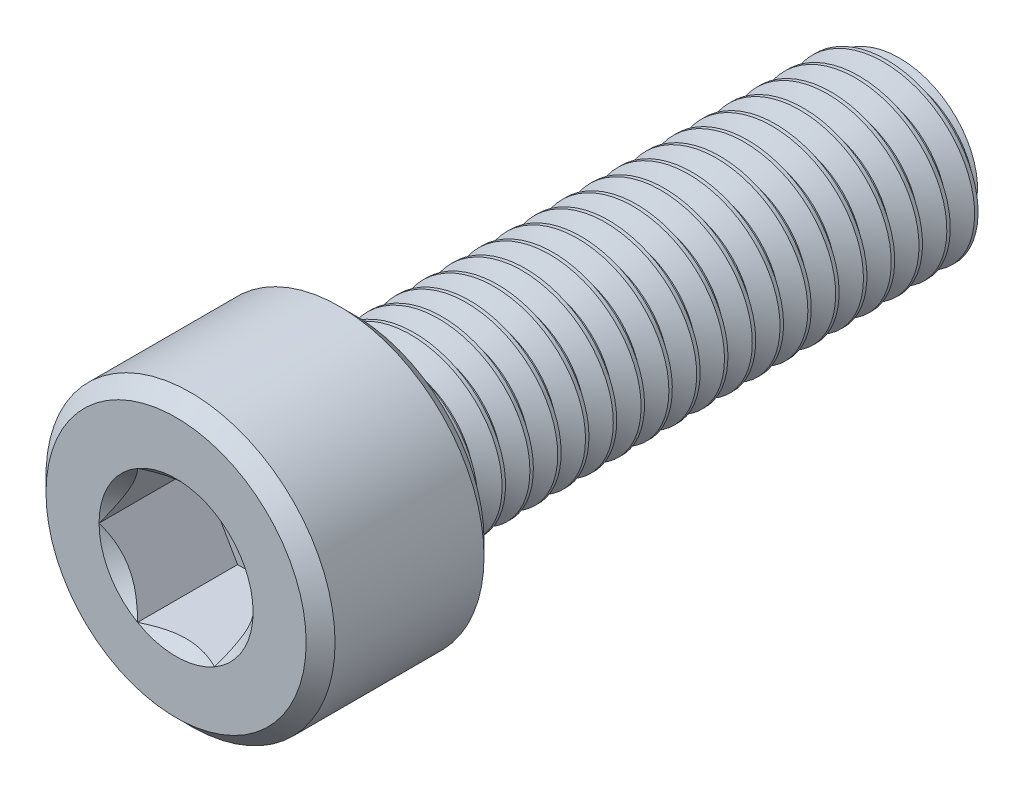
from build123d import *

# Parameters (mm, degrees)
SKETCH1_R           = 4
BOSS_EXTRUDE1_DEPTH = 25
CUT_SWEEP1_PITCH    = 1.25
SKETCH5_R           = 6.5
BOSS_EXTRUDE2_DEPTH = 8
CUT_EXTRUDE1_DEPTH  = 4.5
CHAMFER1_SIZE       = 0.65


with BuildPart() as part:
    # Sketch1 → Boss-Extrude1 (new body)
    with BuildSketch(Plane.XY):
        Circle(SKETCH1_R)
    extrude(amount=BOSS_EXTRUDE1_DEPTH)

    # Cut-Sweep1: the profile of Sketch3 screwed along a right-hand helix of 36 turns, 8 arcs to a turn; built about Z, then put on its axis
    cut_sweep1_z = Axis((0, 0, 0), (0, 0, 1))
    cut_sweep1_corners = [(4, 0, 0), (4, 0.054343923, -1.092649412), (3.187668171, 0.031046574, -0.624228412), (3.187668171, 0.023297349, -0.468421)]
    with BuildLine(mode=Mode.PRIVATE) as cut_sweep1_profile:
        Line(cut_sweep1_corners[0], cut_sweep1_corners[1])
        Line(cut_sweep1_corners[1], cut_sweep1_corners[2])
        Line(cut_sweep1_corners[2], cut_sweep1_corners[3])
        Line(cut_sweep1_corners[3], cut_sweep1_corners[0])
    cut_sweep1_cap = Face(cut_sweep1_profile.wire())
    cut_sweep1_turn_angles = [0, 22.5, 45, 67.5, 90, 112.5, 135, 157.5, 180, 202.5, 225, 247.5, 270, 292.5, 315, 337.5, 360]
    cut_sweep1_turn_weights = [1, 0.9238795325112867, 1, 0.9238795325112867, 1, 0.9238795325112867, 1, 0.9238795325112867, 1, 0.9238795325112867, 1, 0.9238795325112867, 1, 0.9238795325112867, 1, 0.9238795325112867, 1]
    cut_sweep1_turn_rails = [Edge.make_bspline([Vector(p[0], p[1], 0).rotate(cut_sweep1_z, cut_sweep1_turn_angles[k]) / cut_sweep1_turn_weights[k] + Vector(0, 0, p[2] + CUT_SWEEP1_PITCH * cut_sweep1_turn_angles[k] / 360) for k in range(17)], [0, 0, 0, 1, 1, 2, 2, 3, 3, 4, 4, 5, 5, 6, 6, 7, 7, 8, 8, 8], 2, cut_sweep1_turn_weights) for p in cut_sweep1_corners]
    cut_sweep1_turn_sides = [Face.make_surface_from_curves(cut_sweep1_turn_rails[p[0]], cut_sweep1_turn_rails[p[1]]) for p in [(0, 1), (1, 2), (2, 3), (3, 0)]]
    cut_sweep1 = Plane(origin=(0, 0, 0), x_dir=(0, 1, 0), z_dir=(0, 0, 1)) * Solid(Shell([*[p.moved(Location((0, 0, CUT_SWEEP1_PITCH * i))) for i in range(36) for p in cut_sweep1_turn_sides], cut_sweep1_cap, cut_sweep1_cap.rotate(cut_sweep1_z, 12960).moved(Location((0, 0, CUT_SWEEP1_PITCH * 12960 / 360)))]))
    add(cut_sweep1, mode=Mode.SUBTRACT)

    # Sketch4 → Cut-Revolve1 (revolve, cut)
    with BuildSketch(Plane(origin=(0, 0, 0), x_dir=(0, 0, -1), z_dir=(1, 0, 0)), mode=Mode.PRIVATE) as cut_revolve1_sk:
        Polygon((0, 5), (-1.446861123, 5), (0, 2.933668171), align=None)
    revolve(cut_revolve1_sk.sketch.rotate(Axis((0, 0, 0), (0, 0, -1)), 90), axis=Axis((0, 0, 0), (0, 0, -1)), mode=Mode.SUBTRACT)

    # Sketch5 → Boss-Extrude2 (add)
    with BuildSketch(Plane.XY.offset(25)):
        Circle(SKETCH5_R)
    extrude(amount=BOSS_EXTRUDE2_DEPTH)

    # Sketch6 → Cut-Extrude1 (cut)
    with BuildSketch(Plane.XY.offset(33)):
        Polygon((1.732050808, 3), (-1.732050808, 3), (-3.464101615, 0), (-1.732050808, -3), (1.732050808, -3), (3.464101615, 0), align=None)
    extrude(amount=-CUT_EXTRUDE1_DEPTH, mode=Mode.SUBTRACT)

    # Cut-Extrude2 cone 1 section (through the dimple's axis) → Cut-Extrude2 (revolve, cut)
    with BuildSketch(Plane(origin=(0, 0, 33), x_dir=(0, -1, 0), z_dir=(1, 0, 0))):
        Polygon((0, 0), (3.464101615, 0), (0, 3.464101615), align=None)
    revolve(axis=Axis((0, 0, 33), (0, 0, -1)), mode=Mode.SUBTRACT)

    # Chamfer1
    chamfer1_edges = [part.edges().sort_by_distance(p)[0] for p in [
        (-6.5, 0, 25),
        (-6.5, 0, 33),
    ]]
    chamfer(chamfer1_edges, length=CHAMFER1_SIZE)


solid = part.part
